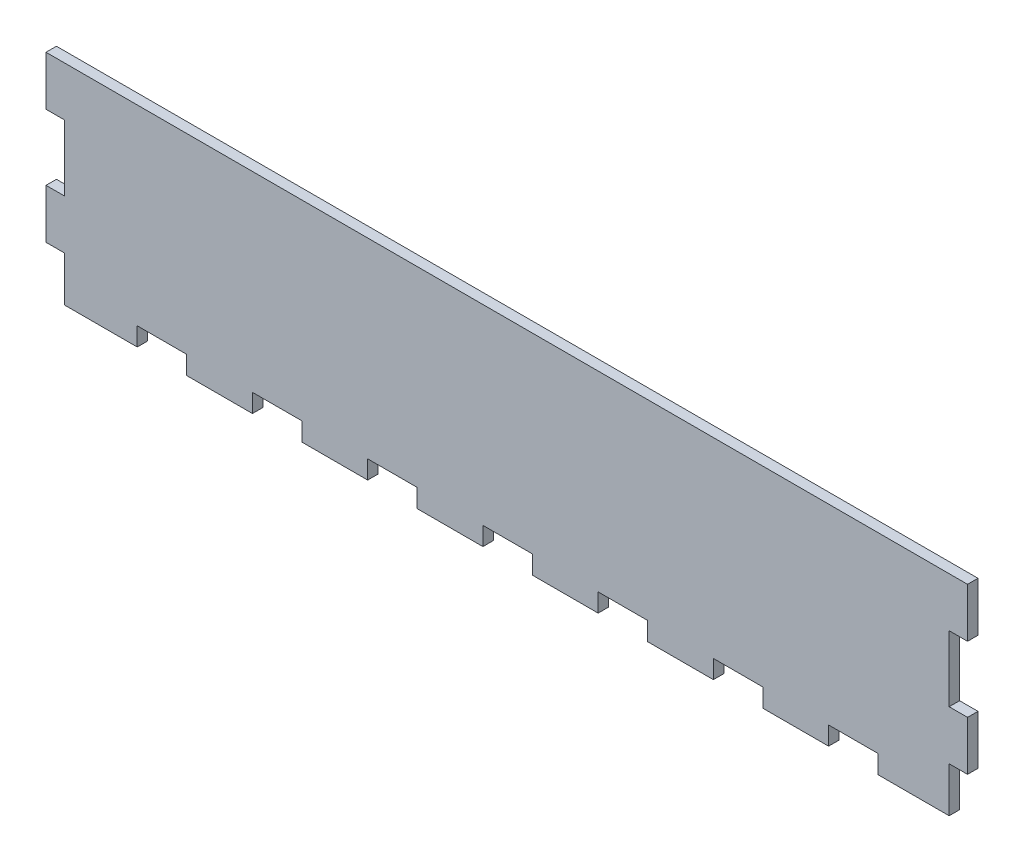
from build123d import *

# Parameters (mm, degrees)
BOSS_EXTRUDE1_DEPTH = 3.175


with BuildPart() as part:
    # Sketch27 → Boss-Extrude1 (new body)
    with BuildSketch(Plane.XY):
        Polygon((274.706390942, -237.675638882), (274.706390942, -252.675638882), (269.118390942, -252.675638882), (269.118390942, -266.360140559), (247.506390942, -266.360140559), (247.506390942, -260.772140559), (232.506390942, -260.772140559), (232.506390942, -266.360140559), (212.506390942, -266.360140559), (212.506390942, -260.772140559), (197.506390942, -260.772140559), (197.506390942, -266.360140559), (177.506390942, -266.360140559), (177.506390942, -260.772140559), (162.506390942, -260.772140559), (162.506390942, -266.360140559), (142.506390942, -266.360140559), (142.506390942, -260.772140559), (127.506390942, -260.772140559), (127.506390942, -266.360140559), (107.506390942, -266.360140559), (107.506390942, -260.772140559), (92.506390942, -260.772140559), (92.506390942, -266.360140559), (72.506390942, -266.360140559), (72.506390942, -260.772140559), (57.506390942, -260.772140559), (57.506390942, -266.360140559), (37.506390942, -266.360140559), (37.506390942, -260.772140559), (22.506390942, -260.772140559), (22.506390942, -266.360140559), (0.386390942, -266.360140559), (0.386390942, -252.675638882), (-5.201609058, -252.675638882), (-5.201609058, -237.675638882), (0.386390942, -237.675638882), (0.386390942, -217.675638882), (-5.201609058, -217.675638882), (-5.201609058, -202.675638882), (274.706390942, -202.675638882), (274.706390942, -217.675638882), (269.118390942, -217.675638882), (269.118390942, -237.675638882), align=None)
    extrude(amount=BOSS_EXTRUDE1_DEPTH)


solid = part.part
